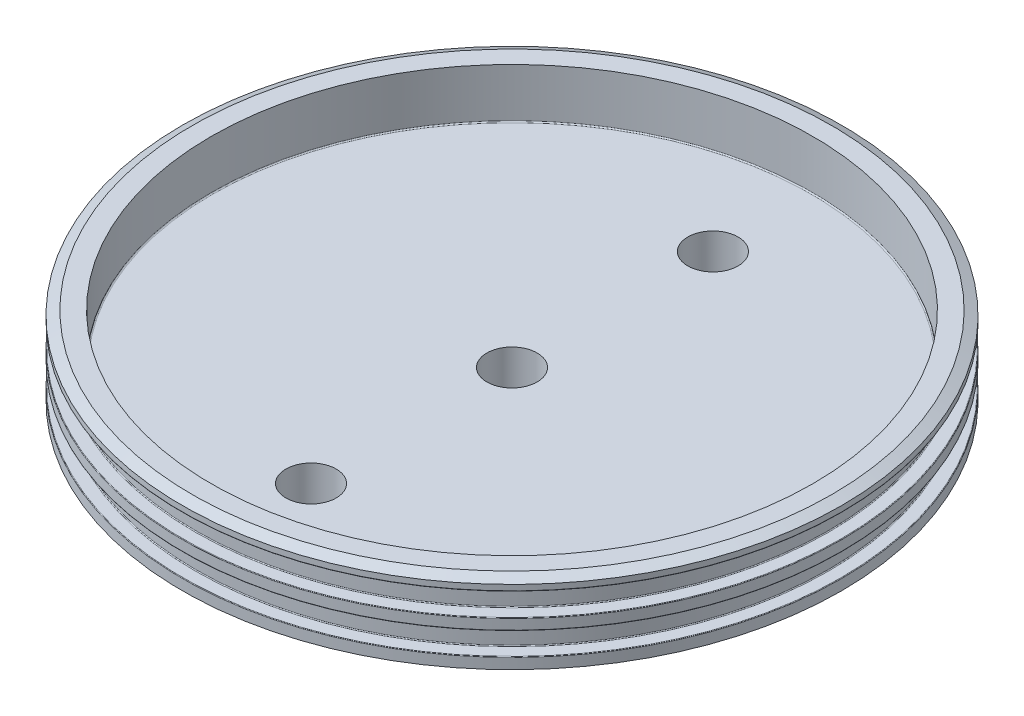
from build123d import *

# Parameters (mm, degrees)
SKETCH6_R                                = 66.04
BOSS_EXTRUDE1_DEPTH                      = 2.54
PIPE_TAP_DRILL_FOR_1_4_TAP_GN2_D         = 11.1252
CNC_ID_FILLET_R                          = 0.1778
CNC_OD_FILLET_R                          = 0.127
CNC_CHAMFERS_SIZE                        = 1.016
CNC_CHAMFERS_SIZE2                       = 2.178819031
CNC_BORE_FILLET_R                        = 0.254
PIPE_TAP_DRILL_FOR_1_4_TAP_RELIEF_VALV_D = 11.1252
PIPE_TAP_DRILL_FOR_1_4_TAP_VENT_VALVE_D  = 11.1252


with BuildPart() as part:
    # Sketch1 → Revolve1 (revolve)
    with BuildSketch(Plane.XY):
        Polygon((0, 0), (72.898, 0), (72.898, 2.4638), (69.977, 2.4638), (69.977, 7.4422), (72.898, 7.4422), (72.898, 9.906), (69.977, 9.906), (69.977, 14.986), (72.898, 14.986), (72.898, 17.3482), (66.548, 17.3482), (66.548, 6.35), (0, 6.35), align=None)
    revolve(axis=Axis((0, 48.192213231, 0), (0, -1, 0)))

    # Sketch6 → Boss-Extrude1 (add)
    with BuildSketch(Plane.XZ):
        Circle(SKETCH6_R)
    extrude(amount=BOSS_EXTRUDE1_DEPTH)

    # Pipe Tap Drill for 1/4 Tap - GN2 (through all)
    with Locations(Plane(origin=(0, 6.35, 0), x_dir=(1, 0, 0), z_dir=(0, 1, 0))):
        with Locations((0, 0)):
            Hole(PIPE_TAP_DRILL_FOR_1_4_TAP_GN2_D / 2)

    # CNC ID Fillet
    cnc_id_fillet_edges = [part.edges().sort_by_distance(p)[0] for p in [
        (-69.977, 7.4422, 0),
        (-69.977, 2.4638, 0),
        (-69.977, 14.986, 0),
        (-69.977, 9.906, 0),
        (-66.04, 0, 0),
    ]]
    fillet(cnc_id_fillet_edges, radius=CNC_ID_FILLET_R)

    # CNC OD Fillet
    cnc_od_fillet_edges = [part.edges().sort_by_distance(p)[0] for p in [
        (-72.898, 7.4422, 0),
        (-72.898, 2.4638, 0),
        (-66.04, -2.54, 0),
        (-72.898, 14.986, 0),
        (-72.898, 9.906, 0),
    ]]
    fillet(cnc_od_fillet_edges, radius=CNC_OD_FILLET_R)

    # CNC Chamfers
    cnc_chamfers_edges = [part.edges().sort_by_distance(p)[0] for p in [
        (-72.898, 17.3482, 0),
    ]]
    cnc_chamfers_side = [part.faces().sort_by_distance(p)[0] for p in [
        (-72.898, 16.2306, 0),
    ]]
    chamfer(cnc_chamfers_edges, length=CNC_CHAMFERS_SIZE, length2=CNC_CHAMFERS_SIZE2, reference=cnc_chamfers_side[0])

    # CNC Bore Fillet
    cnc_bore_fillet_edges = [part.edges().sort_by_distance(p)[0] for p in [
        (-66.548, 6.35, 0),
    ]]
    fillet(cnc_bore_fillet_edges, radius=CNC_BORE_FILLET_R)

    # Pipe Tap Drill for 1/4 Tap - Relief Valve (through all)
    with Locations(Plane(origin=(0, -2.54, 0), x_dir=(-1, 0, 0), z_dir=(0, -1, 0))):
        with Locations((0, 44.45)):
            Hole(PIPE_TAP_DRILL_FOR_1_4_TAP_RELIEF_VALV_D / 2)

    # Pipe Tap Drill for 1/4 Tap - Vent Valve (through all)
    with Locations(Plane(origin=(0, -2.54, 0), x_dir=(-1, 0, 0), z_dir=(0, -1, 0))):
        with Locations((0, -44.45)):
            Hole(PIPE_TAP_DRILL_FOR_1_4_TAP_VENT_VALVE_D / 2)


solid = part.part
